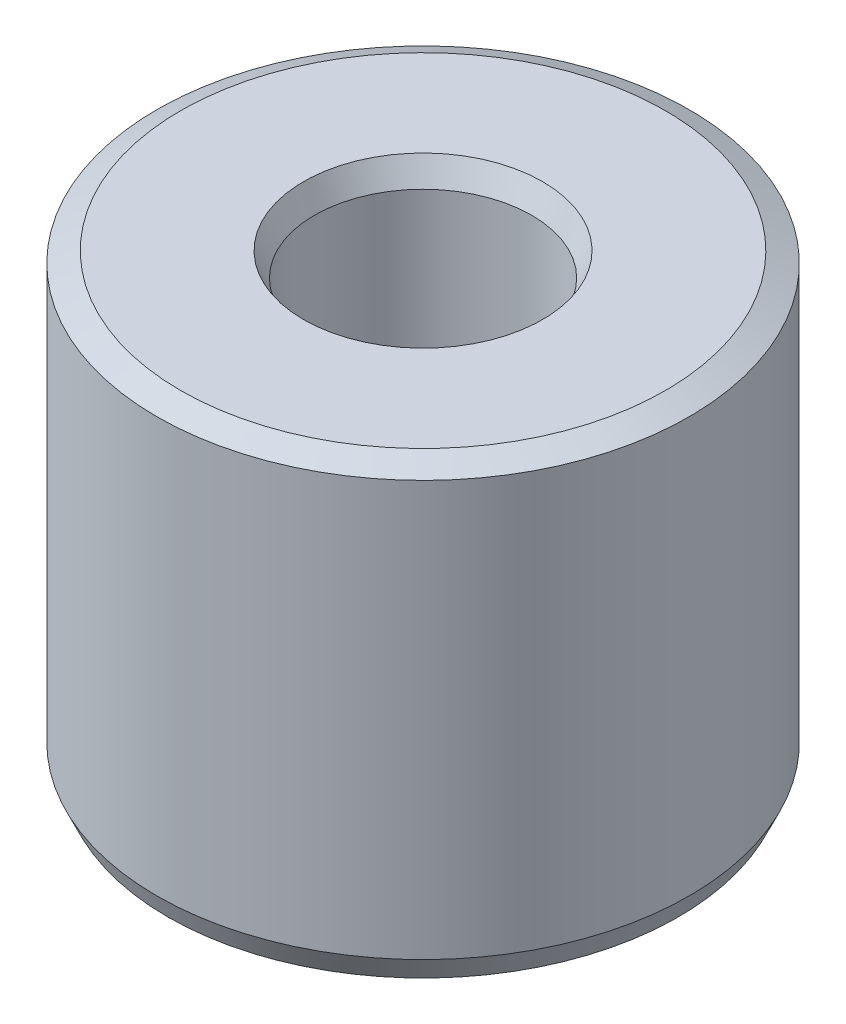
from build123d import *
from OCP.BRepFilletAPI import BRepFilletAPI_MakeChamfer

# Parameters (mm, degrees)
SKETCH1_R           = 27.5
BOSS_EXTRUDE1_DEPTH = 46.465123757
SKETCH2_R           = 11.227914785
CUT_EXTRUDE1_DEPTH  = 61.592967626
CHAMFER1_SIZE       = 1.125873463
CHAMFER1_SIZE2      = 2.447469693


with BuildPart() as part:
    # Sketch1 → Boss-Extrude1 (new body)
    with BuildSketch(Plane(origin=(0, 0, 0), x_dir=(1, 0, 0), z_dir=(0, 1, 0))):
        Circle(SKETCH1_R)
    extrude(amount=BOSS_EXTRUDE1_DEPTH)

    # Sketch2 → Cut-Extrude1 (cut, through all)
    with BuildSketch(Plane(origin=(0, 0, 0), x_dir=(1, 0, 0), z_dir=(0, 1, 0))):
        Circle(SKETCH2_R)
    extrude(amount=CUT_EXTRUDE1_DEPTH, mode=Mode.SUBTRACT)

    # Chamfer1: one chamfer whose edges measure the first distance from different faces: ONE call of the kernel's chamfer builder (chamfer() names one face for all edges)
    chamfer1_edges_1 = [part.edges().sort_by_distance(p)[0] for p in [
        (-11.227914785, 46.465123757, 0),
    ]]
    chamfer1_side_1 = [part.faces().sort_by_distance(p)[0] for p in [
        (-26.722182541, 46.465123757, 0),
    ]]
    chamfer1_edges_2 = [part.edges().sort_by_distance(p)[0] for p in [
        (-11.227914785, 0, 0),
    ]]
    chamfer1_side_2 = [part.faces().sort_by_distance(p)[0] for p in [
        (-11.227914785, 23.232561878, 0),
    ]]
    chamfer1_edges_3 = [part.edges().sort_by_distance(p)[0] for p in [
        (-27.5, 0, 0),
    ]]
    chamfer1_side_3 = [part.faces().sort_by_distance(p)[0] for p in [
        (-26.722182541, 0, 0),
    ]]
    chamfer1_edges_4 = [part.edges().sort_by_distance(p)[0] for p in [
        (-27.5, 46.465123757, 0),
    ]]
    chamfer1_side_4 = [part.faces().sort_by_distance(p)[0] for p in [
        (-27.5, 23.232561878, 0),
    ]]
    chamfer1 = BRepFilletAPI_MakeChamfer(part.part.solid().wrapped)
    for e in chamfer1_edges_1:
        chamfer1.Add(CHAMFER1_SIZE, CHAMFER1_SIZE2, e.wrapped, chamfer1_side_1[0].wrapped)  # the first distance lies on this face
    for e in chamfer1_edges_2:
        chamfer1.Add(CHAMFER1_SIZE, CHAMFER1_SIZE2, e.wrapped, chamfer1_side_2[0].wrapped)  # the first distance lies on this face
    for e in chamfer1_edges_3:
        chamfer1.Add(CHAMFER1_SIZE, CHAMFER1_SIZE2, e.wrapped, chamfer1_side_3[0].wrapped)  # the first distance lies on this face
    for e in chamfer1_edges_4:
        chamfer1.Add(CHAMFER1_SIZE, CHAMFER1_SIZE2, e.wrapped, chamfer1_side_4[0].wrapped)  # the first distance lies on this face
    add(Compound.cast(chamfer1.Shape()), mode=Mode.REPLACE)


solid = part.part
